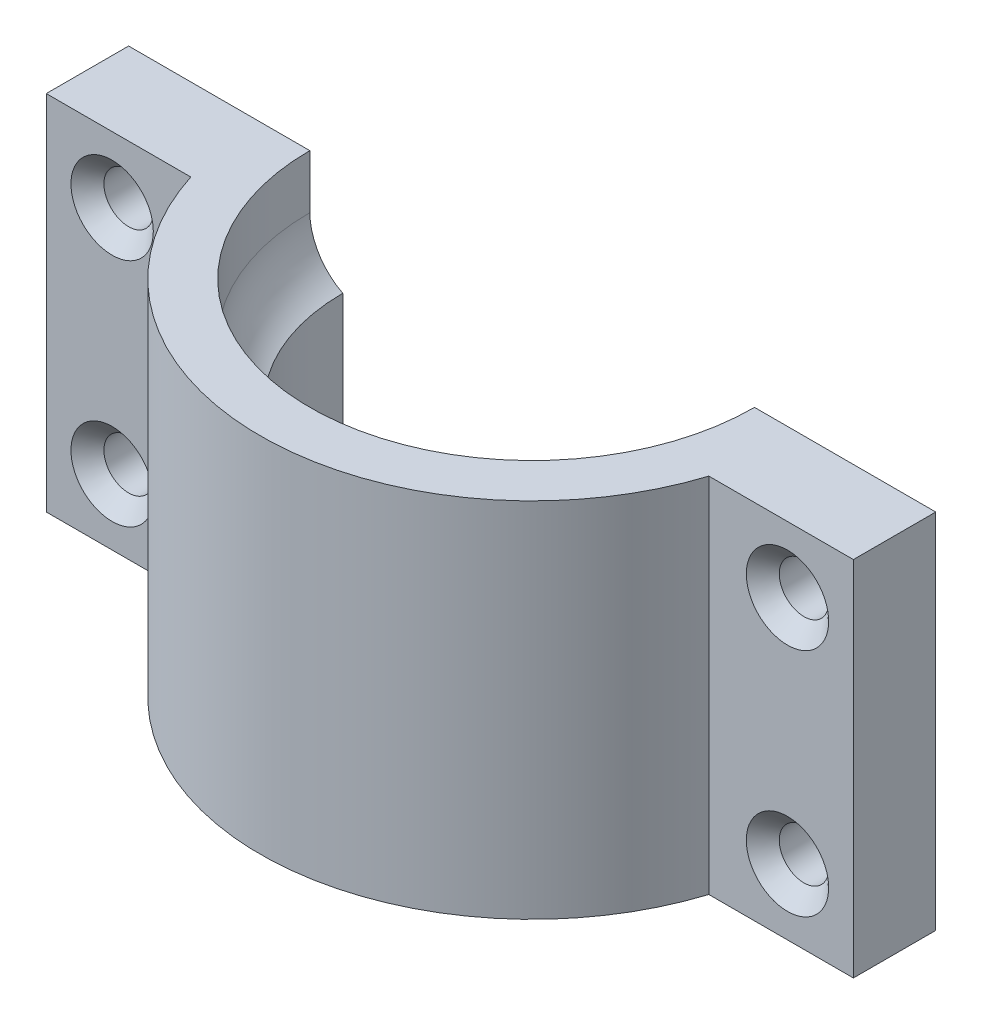
from build123d import *

# Parameters (mm, degrees)
BOSS_EXTRUDE1_DEPTH     = 22
BOSS_EXTRUDE3_START     = -5
BOSS_EXTRUDE3_OUTLINE_R = 1.5
BOSS_EXTRUDE3_DEPTH     = 5
CHAMFER2_SIZE           = 1


# Read off the part's stored shape, not the designer's step: Boss-Extrude3
with BuildPart() as part:
    # Sketch1 → Boss-Extrude1 (new body)
    with BuildSketch(Plane(origin=(0, 0, 0), x_dir=(1, 0, 0), z_dir=(0, 1, 0))):
        with BuildLine():
            Line((0, -16.5), (0, -11.5))
            ThreePointArc((0, -11.5), (-8.131727984, -8.131727984), (-11.5, 0))
            Line((-11.5, 0), (-16.5, 0))
            Line((-16.5, 0), (-24.5, 0))
            Line((-24.5, 0), (-24.5, -5))
            Line((-24.5, -5), (-15.724185194, -5))
            ThreePointArc((-15.724185194, -5), (-9.740379869, -13.318220602), (0, -16.5))
        make_face()
        with BuildLine():
            Line((24.5, 0), (16.5, 0))
            Line((16.5, 0), (11.5, 0))
            ThreePointArc((11.5, 0), (8.131727984, -8.131727984), (0, -11.5))
            Line((0, -11.5), (0, -16.5))
            ThreePointArc((0, -16.5), (9.740379869, -13.318220602), (15.724185194, -5))
            Line((15.724185194, -5), (24.5, -5))
            Line((24.5, -5), (24.5, 0))
        make_face()
    extrude(amount=-BOSS_EXTRUDE1_DEPTH)

    # Boss-Extrude3 outline → Boss-Extrude3 (cut)
    with BuildSketch(Plane.XY.offset(5).offset(BOSS_EXTRUDE3_START)):
        with Locations((20.5, -18)):
            Circle(BOSS_EXTRUDE3_OUTLINE_R)
        with Locations((20.5, -4)):
            Circle(BOSS_EXTRUDE3_OUTLINE_R)
        with Locations((-20.5, -4)):
            Circle(BOSS_EXTRUDE3_OUTLINE_R)
        with Locations((-20.5, -18)):
            Circle(BOSS_EXTRUDE3_OUTLINE_R)
    extrude(amount=BOSS_EXTRUDE3_DEPTH, mode=Mode.SUBTRACT)

    # Chamfer2
    chamfer2_edges = [part.edges().sort_by_distance(p)[0] for p in [
        (-22, -18, 5),
        (19, -4, 5),
        (19, -18, 5),
        (-22, -4, 5),
    ]]
    chamfer(chamfer2_edges, length=CHAMFER2_SIZE)

    # Sketch4 → Cut-Revolve2 (revolve, cut)
    with BuildSketch(Plane(origin=(0, 0, 0), x_dir=(-1, 0, 0), z_dir=(0, 0, -1))):
        with BuildLine():
            Line((-11.5, 0), (-11.5, -6.5))
            ThreePointArc((-11.5, -6.5), (-12.947807153, -5.158599205), (-13.5, -3.263715381))
            Line((-13.5, -3.263715381), (-13.5, 0))
            Line((-13.5, 0), (-11.5, 0))
        make_face()
    revolve(axis=Axis((0, 2.834255205, 0), (0, -1, 0)), mode=Mode.SUBTRACT)


solid = part.part
